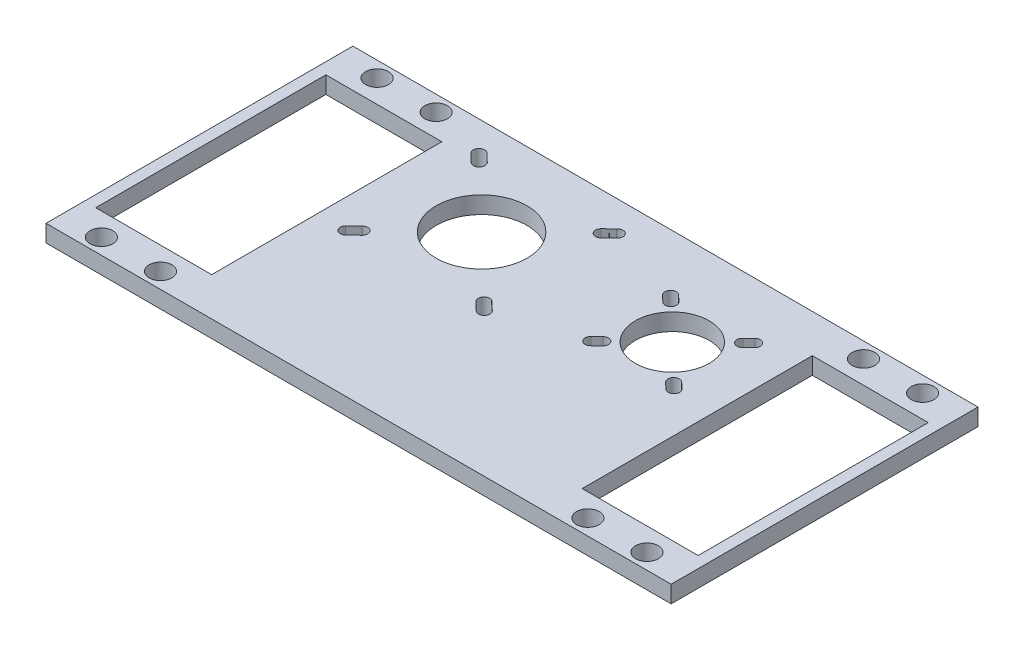
from build123d import *

# Parameters (mm, degrees)
ESQUISSE1_W             = 110
ESQUISSE1_H             = 54
BOSS_EXTRU_1_DEPTH      = 3
ESQUISSE2_R             = 2
ESQUISSE2_W             = 20.4
ESQUISSE2_H             = 40.5
ENL_V_MAT_EXTRU_1_DEPTH = 46
ESQUISSE3_R             = 8
ENL_V_MAT_EXTRU_2_DEPTH = 10
ESQUISSE3_3_R           = 6.5
ENL_V_MAT_EXTRU_3_DEPTH = 15


with BuildPart() as part:
    # Esquisse1 → Boss.-Extru.1 (new body)
    with BuildSketch(Plane(origin=(0, 0, 0), x_dir=(1, 0, 0), z_dir=(0, 1, 0))):
        with Locations((1, 8.02173913)):
            Rectangle(ESQUISSE1_W, ESQUISSE1_H)
    extrude(amount=BOSS_EXTRU_1_DEPTH)

    # Esquisse2 → Enlèv. mat.-Extru.1 (cut)
    with BuildSketch(Plane(origin=(0, 3, 0), x_dir=(1, 0, 0), z_dir=(0, 1, 0))):
        with Locations((-47, 32.27173913)):
            Circle(ESQUISSE2_R)
        with Locations((-36.6, 32.27173913)):
            Circle(ESQUISSE2_R)
        with Locations((-47, -16.22826087)):
            Circle(ESQUISSE2_R)
        with Locations((-36.6, -16.22826087)):
            Circle(ESQUISSE2_R)
        with Locations((38.6, 32.27173913)):
            Circle(ESQUISSE2_R)
        with Locations((49, 32.27173913)):
            Circle(ESQUISSE2_R)
        with Locations((38.6, -16.22826087)):
            Circle(ESQUISSE2_R)
        with Locations((49, -16.22826087)):
            Circle(ESQUISSE2_R)
        with Locations((-41.8, 8.02173913)):
            Rectangle(ESQUISSE2_W, ESQUISSE2_H)
        with Locations((43.8, 8.02173913)):
            Rectangle(ESQUISSE2_W, ESQUISSE2_H)
    extrude(amount=-ENL_V_MAT_EXTRU_1_DEPTH, mode=Mode.SUBTRACT)

    # Esquisse3 → Enlèv. mat.-Extru.2 (cut)
    # profile 1 of 5: a face of its own
    with BuildSketch(Plane(origin=(0, 3, 0), x_dir=(1, 0, 0), z_dir=(0, 1, 0))):
        with BuildLine():
            ThreePointArc((-2.853212891, 8.352121882), (-4.239560885, 8.342742313), (-4.284222232, 6.957082145))
            Line((-4.284222232, 6.957082145), (-2.794071168, 5.520408016))
            ThreePointArc((-2.794071168, 5.520408016), (-2.081119908, 5.240492653), (-1.379244694, 5.547124831))
            ThreePointArc((-1.379244694, 5.547124831), (-1.100190097, 6.259812023), (-1.406818642, 6.961077618))
            Line((-1.406818642, 6.961077618), (-2.853212891, 8.352121882))
        make_face()
    # profile 2 of 5: a face of its own
    with BuildSketch(Plane(origin=(0, 3, 0), x_dir=(1, 0, 0), z_dir=(0, 1, 0))):
        with BuildLine():
            Line((-2.946598895, 30.368373979), (-4.339317042, 29.036187436))
            ThreePointArc((-4.339317042, 29.036187436), (-4.338421569, 27.643742271), (-2.946598895, 27.602101147))
            Line((-2.946598895, 27.602101147), (-1.486460884, 29.005937397))
            ThreePointArc((-1.486460884, 29.005937397), (-1.497310818, 30.45795054), (-2.946598895, 30.368373979))
        make_face()
        with BuildLine():
            Line((-2.946598895, 29.078751818), (-2.946598895, 29.085237293))
            ThreePointArc((-2.946598895, 29.085237293), (-2.923891235, 29.059025101), (-2.900288323, 29.033616059))
            ThreePointArc((-2.900288323, 29.033616059), (-2.923078661, 29.056558386), (-2.946598895, 29.078751818))
        make_face(mode=Mode.SUBTRACT)
    # profile 3 of 5: a face of its own
    with BuildSketch(Plane(origin=(0, 3, 0), x_dir=(1, 0, 0), z_dir=(0, 1, 0))):
        with BuildLine():
            ThreePointArc((-27.268724522, 6.980213998), (-27.25388726, 5.637030161), (-25.915693612, 5.520408016))
            Line((-25.915693612, 5.520408016), (-24.388077775, 6.980213998))
            ThreePointArc((-24.388077775, 6.980213998), (-24.35598558, 8.394063386), (-25.769834968, 8.42615558))
            Line((-25.769834968, 8.42615558), (-27.268724522, 6.980213998))
        make_face()
    # profile 4 of 5: a face of its own
    with BuildSketch(Plane(origin=(0, 3, 0), x_dir=(1, 0, 0), z_dir=(0, 1, 0))):
        with BuildLine():
            ThreePointArc((-25.922899604, 30.539187517), (-27.328367406, 30.488483643), (-27.293189577, 29.082541558))
            Line((-27.293189577, 29.082541558), (-25.851678965, 27.696162405))
            ThreePointArc((-25.851678965, 27.696162405), (-24.437692265, 27.723771617), (-24.46538678, 29.137756649))
            Line((-24.46538678, 29.137756649), (-25.922899604, 30.539187517))
        make_face()
        with BuildLine():
            ThreePointArc((-25.879244694, 29.110107288), (-25.883082581, 29.106094542), (-25.886898128, 29.102060549))
            Line((-25.886898128, 29.102060549), (-25.887293629, 29.117848386))
            Line((-25.887293629, 29.117848386), (-25.879244694, 29.110107288))
        make_face(mode=Mode.SUBTRACT)
    # profile 5 of 5: a face of its own
    with BuildSketch(Plane(origin=(0, 3, 0), x_dir=(1, 0, 0), z_dir=(0, 1, 0))):
        with Locations((-14.35, 18.021805636)):
            Circle(ESQUISSE3_R)
    extrude(amount=-ENL_V_MAT_EXTRU_2_DEPTH, mode=Mode.SUBTRACT)


with BuildPart() as enl_v_mat_extru_2_piece_1:
    # of the separate pieces the step leaves, piece 1, a body of its own (enl_v_mat_extru_2_pieces)
    add(part.part.solids().sort_by_distance((-54, 0, -35.02173913))[0])

    # Esquisse3<3> → Enlèv. mat.-Extru.3 (cut)
    with BuildSketch(Plane(origin=(0, 3, 0), x_dir=(1, 0, 0), z_dir=(0, 1, 0))):
        with BuildLine():
            Line((26.210548289, 23.366386245), (27.292571762, 24.405243888))
            ThreePointArc((27.292571762, 24.405243888), (27.321348982, 25.819164632), (25.907428238, 25.847941852))
            Line((25.907428238, 25.847941852), (24.825404764, 24.809084209))
            ThreePointArc((24.825404764, 24.809084209), (24.796627544, 23.395163465), (26.210548289, 23.366386245))
        make_face()
        with Locations((19.2, 18.021805636)):
            Circle(ESQUISSE3_3_R)
        with BuildLine():
            ThreePointArc((12.575674255, 25.768154618), (11.161753511, 25.739377398), (11.190530731, 24.325456654))
            Line((11.190530731, 24.325456654), (12.272554204, 23.286599011))
            ThreePointArc((12.272554204, 23.286599011), (13.686474949, 23.315376231), (13.657697729, 24.729296975))
            Line((13.657697729, 24.729296975), (12.575674255, 25.768154618))
        make_face()
        with BuildLine():
            ThreePointArc((25.824325745, 10.275456654), (27.238246489, 10.304233874), (27.209469269, 11.718154618))
            Line((27.209469269, 11.718154618), (26.127445796, 12.757012262))
            ThreePointArc((26.127445796, 12.757012262), (24.713525051, 12.728235042), (24.742302271, 11.314314297))
            Line((24.742302271, 11.314314297), (25.824325745, 10.275456654))
        make_face()
        with BuildLine():
            ThreePointArc((11.190530731, 11.718154618), (11.161753511, 10.304233874), (12.575674255, 10.275456654))
            Line((12.575674255, 10.275456654), (13.657697729, 11.314314297))
            ThreePointArc((13.657697729, 11.314314297), (13.686474949, 12.728235042), (12.272554204, 12.757012262))
            Line((12.272554204, 12.757012262), (11.190530731, 11.718154618))
        make_face()
    extrude(amount=-ENL_V_MAT_EXTRU_3_DEPTH, mode=Mode.SUBTRACT)


with BuildPart() as enl_v_mat_extru_2_piece_2:
    # of the separate pieces the step leaves, piece 2, a body of its own (enl_v_mat_extru_2_pieces)
    add(part.part.solids().sort_by_distance((-2.946598895, 0, -29.085237293))[0])


with BuildPart() as enl_v_mat_extru_2_piece_3:
    # of the separate pieces the step leaves, piece 3, a body of its own (enl_v_mat_extru_2_pieces)
    add(part.part.solids().sort_by_distance((-25.879244694, 0, -29.110107288))[0])


solid = Compound([enl_v_mat_extru_2_piece_1.part, enl_v_mat_extru_2_piece_2.part, enl_v_mat_extru_2_piece_3.part])
